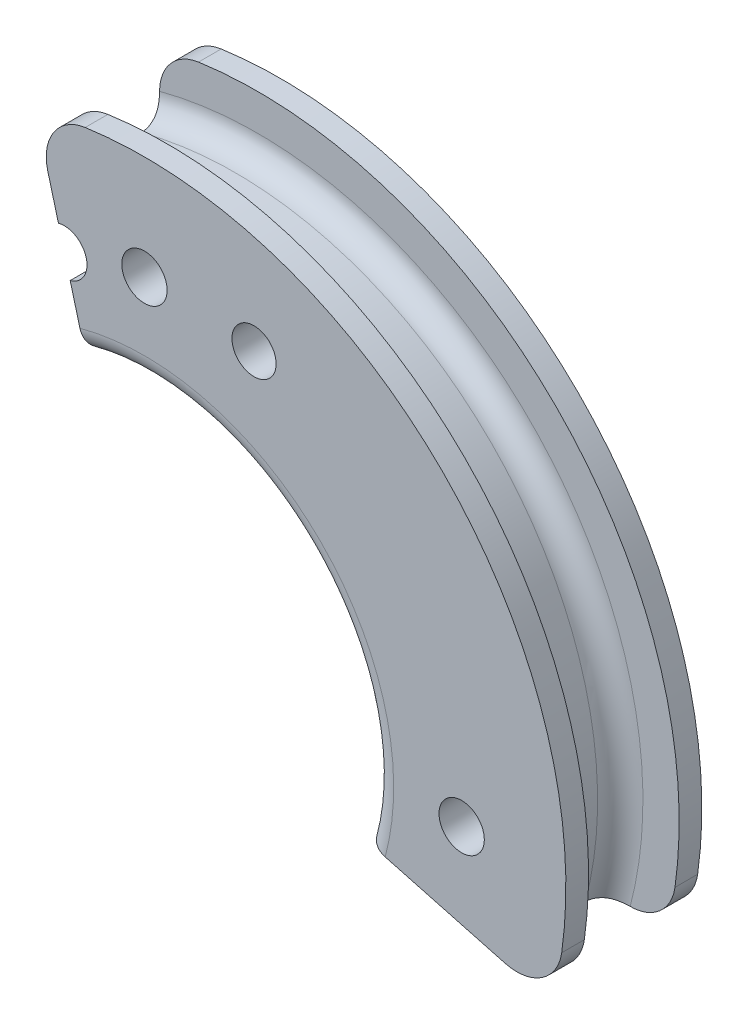
from build123d import *

# Parameters (mm, degrees)
SKETCH1_R               = 8.5
SKETCH1_R_2             = 0.5
SKETCH1_R_3             = 5
BOSS_EXTRUDE1_DEPTH     = 1.5
SKETCH7_W               = 0.8
SKETCH7_H               = 0.5
CUT_EXTRUDE1_DEPTH      = 14.237446884
CUT_EXTRUDE1_DEPTH_BACK = 14.237446884
CUT_EXTRUDE2_DEPTH      = 14.489996294
CUT_EXTRUDE2_DEPTH_BACK = 14.489996294
SKETCH5_R               = 0.5
SKETCH5_R_2             = 0.48729794
FILLET1_R               = 0.5
FILLET2_R               = 1
CHAMFER1_SIZE           = 1


with BuildPart() as part:
    # Sketch1 → Boss-Extrude1 (new, symmetric)
    with BuildSketch(Plane.XY):
        Circle(SKETCH1_R)
        with Locations((7, 0)):
            Circle(SKETCH1_R_2, mode=Mode.SUBTRACT)
        Circle(SKETCH1_R_3, mode=Mode.SUBTRACT)
        with Locations((0, -7)):
            Circle(SKETCH1_R_2, mode=Mode.SUBTRACT)
        with Locations((-7, 0)):
            Circle(SKETCH1_R_2, mode=Mode.SUBTRACT)
        with Locations((0, 7)):
            Circle(SKETCH1_R_2, mode=Mode.SUBTRACT)
    extrude(amount=BOSS_EXTRUDE1_DEPTH, both=True)

    # Sketch2 → Cut-Revolve1 (revolve, cut)
    with BuildSketch(Plane(origin=(0, 0, 0), x_dir=(1, 0, 0), z_dir=(0, 1, 0)), mode=Mode.PRIVATE) as cut_revolve1_sk:
        with BuildLine():
            Line((-8, 0.5), (-8, -0.5))
            ThreePointArc((-8, -0.5), (-8.146446609, -0.853553391), (-8.5, -1))
            Line((-8.5, -1), (-8.5, 1))
            ThreePointArc((-8.5, 1), (-8.146446609, 0.853553391), (-8, 0.5))
        make_face()
    revolve(cut_revolve1_sk.sketch.rotate(Axis((0, 0, 0), (0, 0, -1)), 180), axis=Axis((0, 0, 0), (0, 0, -1)), mode=Mode.SUBTRACT)

    # Sketch7 → Revolve1 (revolve)
    with BuildSketch(Plane(origin=(0, 0, 0), x_dir=(1, 0, 0), z_dir=(0, 1, 0))):
        with Locations((8.9, 1.25)):
            Rectangle(SKETCH7_W, SKETCH7_H)
        with Locations((8.9, -1.25)):
            Rectangle(SKETCH7_W, SKETCH7_H)
    revolve(axis=Axis((0, 0, 0), (0, 0, -1)))

    # Sketch4 → Cut-Extrude1 (cut, two sides: drawn at the far end of the back side and taken through both)
    with BuildSketch(Plane.XY.offset(-CUT_EXTRUDE1_DEPTH_BACK)):
        Polygon((-2.654263152, 9.905844942), (0, 0), (10.350145374, -2.773313095), (10.350145374, -11.033622271), (-11.334173843, -11.033622271), (-11.334173843, 9.905844942), align=None)
    extrude(amount=CUT_EXTRUDE1_DEPTH + CUT_EXTRUDE1_DEPTH_BACK, mode=Mode.SUBTRACT)

    # Sketch5 → Cut-Extrude2 (cut, two sides: drawn at the far end of the back side and taken through both)
    with BuildSketch(Plane.XY.offset(1.5).offset(-CUT_EXTRUDE2_DEPTH_BACK)):
        with Locations((-1.768253171, 6.599210675)):
            Circle(SKETCH5_R)
        with Locations((2.418011057, 6.794599377)):
            Circle(SKETCH5_R_2)
    extrude(amount=CUT_EXTRUDE2_DEPTH + CUT_EXTRUDE2_DEPTH_BACK, mode=Mode.SUBTRACT)

    # Fillet1
    fillet1_edges = [part.edges().sort_by_distance(p)[0] for p in [
        (3.535533906, 3.535533906, 1.5),
        (3.535533906, 3.535533906, -1.5),
    ]]
    fillet(fillet1_edges, radius=FILLET1_R)

    # Fillet2
    fillet2_edges = [part.edges().sort_by_distance(p)[0] for p in [
        (8.983110184, -2.407017119, -1.25),
        (8.983110184, -2.407017119, 1.25),
        (-2.407017119, 8.983110184, -1.25),
        (-2.407017119, 8.983110184, 1.25),
    ]]
    fillet(fillet2_edges, radius=FILLET2_R)

    # Chamfer1
    chamfer1_edges = [part.edges().sort_by_distance(p)[0] for p in [
        (6.5, 0, -1.5),
        (1.930713118, 6.794599377, -1.5),
    ]]
    chamfer(chamfer1_edges, length=CHAMFER1_SIZE - 0.0001)  # a hair under: the kernel refuses the full size


solid = part.part
